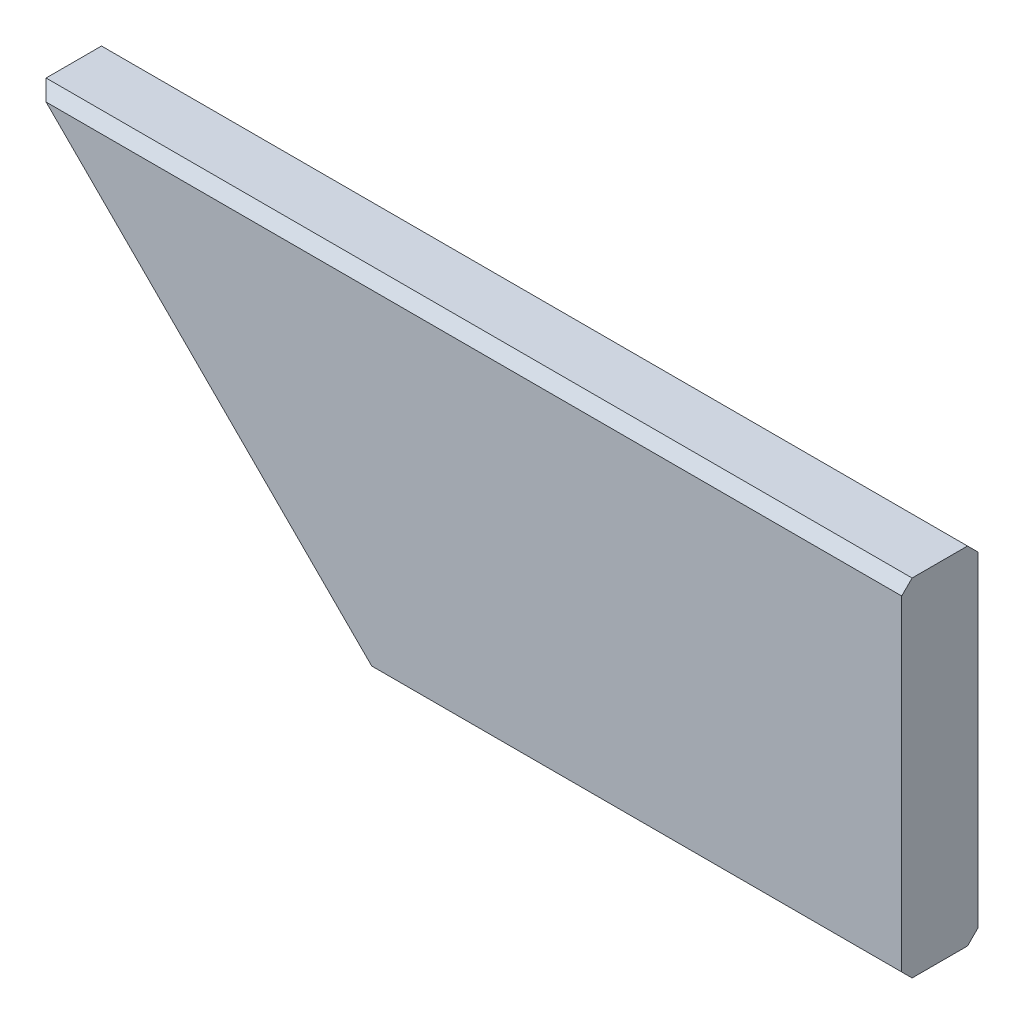
from build123d import *

# Parameters (mm, degrees)
ESQUISSE1_W                  = 1950
ESQUISSE1_H                  = 100
BOSS_EXTRU_1_DEPTH           = 22
ENL_V_MAT_EXTRU_1_DEPTH      = 1953.686354743
ENL_V_MAT_EXTRU_1_DEPTH_BACK = 1953.686354743
CHANFREIN1_SIZE              = 3
ENL_V_MAT_EXTRU_2_DEPTH      = 1953.686354743
ENL_V_MAT_EXTRU_2_DEPTH_BACK = 1953.686354743
ESQUISSE3_W                  = 1050
ESQUISSE3_H                  = 100


with BuildPart() as part:
    # Esquisse1 → Boss.-Extru.1 (new body)
    with BuildSketch(Plane.XY):
        with Locations((975, 50)):
            Rectangle(ESQUISSE1_W, ESQUISSE1_H)
    extrude(amount=BOSS_EXTRU_1_DEPTH)

    # Esquisse2 → Enlèv. mat.-Extru.1 (cut, two sides: drawn at the far end of the back side and taken through both)
    with BuildSketch(Plane(origin=(0, 0, 0), x_dir=(-1, 0, 0), z_dir=(0, 0, -1)).offset(-ENL_V_MAT_EXTRU_1_DEPTH_BACK)):
        Polygon((0, 0), (-750, 0), (-650, 100), (0, 100), align=None)
    extrude(amount=ENL_V_MAT_EXTRU_1_DEPTH + ENL_V_MAT_EXTRU_1_DEPTH_BACK, mode=Mode.SUBTRACT)

    # Chanfrein1
    chanfrein1_edges = [part.edges().sort_by_distance(p)[0] for p in [
        (1350, 0, 0),
        (1350, 0, 22),
        (1300, 100, 0),
        (1300, 100, 22),
    ]]
    chamfer(chanfrein1_edges, length=CHANFREIN1_SIZE)

    # Esquisse3 → Enlèv. mat.-Extru.2 (cut, two sides: drawn at the far end of the back side and taken through both)
    with BuildSketch(Plane(origin=(0, 0, 0), x_dir=(-1, 0, 0), z_dir=(0, 0, -1)).offset(-ENL_V_MAT_EXTRU_2_DEPTH_BACK)):
        with Locations((-1425, 50)):
            Rectangle(ESQUISSE3_W, ESQUISSE3_H)
    extrude(amount=ENL_V_MAT_EXTRU_2_DEPTH + ENL_V_MAT_EXTRU_2_DEPTH_BACK, mode=Mode.SUBTRACT)


solid = part.part
